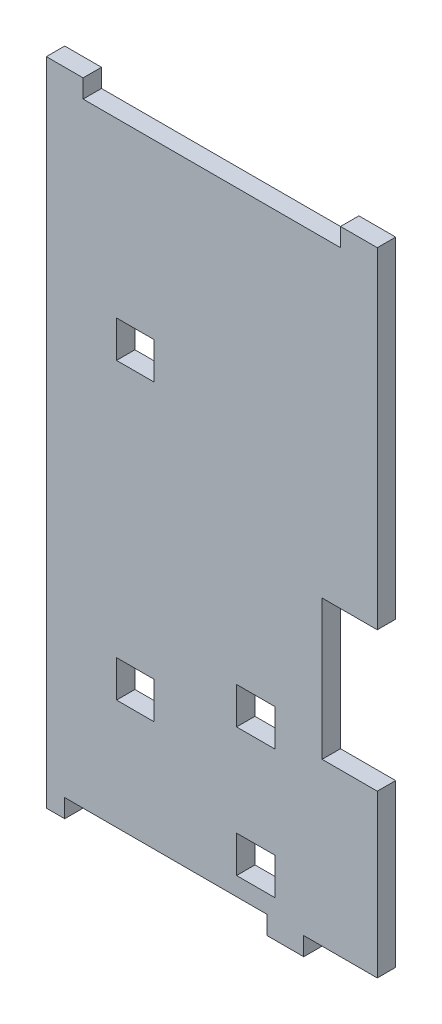
from build123d import *

# Parameters (mm, degrees)
ESQUISSE1_W        = 10.465871206
ESQUISSE1_H        = 10
ESQUISSE1_W_2      = 10.217145077
BOSS_EXTRU_1_DEPTH = 5


with BuildPart() as part:
    # Esquisse1 → Boss.-Extru.1 (new body)
    with BuildSketch(Plane.XY):
        Polygon((90, 82), (90, 167), (90, 172), (80, 172), (80, 167), (10, 167), (10, 172), (0, 172), (0, 167), (0, 0), (0, -5), (5, -5), (5, 0), (60, 0), (60, -5), (70, -5), (70, 0), (90, 0), (90, 44), (75, 44), (75, 82), align=None)
        with Locations((56.967345119, 45)):
            Rectangle(ESQUISSE1_W, ESQUISSE1_H, mode=Mode.SUBTRACT)
        with Locations((56.967345119, 10)):
            Rectangle(ESQUISSE1_W, ESQUISSE1_H, mode=Mode.SUBTRACT)
        with Locations((24.198717415, 115)):
            Rectangle(ESQUISSE1_W_2, ESQUISSE1_H, mode=Mode.SUBTRACT)
        with Locations((24.198717415, 35)):
            Rectangle(ESQUISSE1_W_2, ESQUISSE1_H, mode=Mode.SUBTRACT)
    extrude(amount=BOSS_EXTRU_1_DEPTH)


solid = part.part
